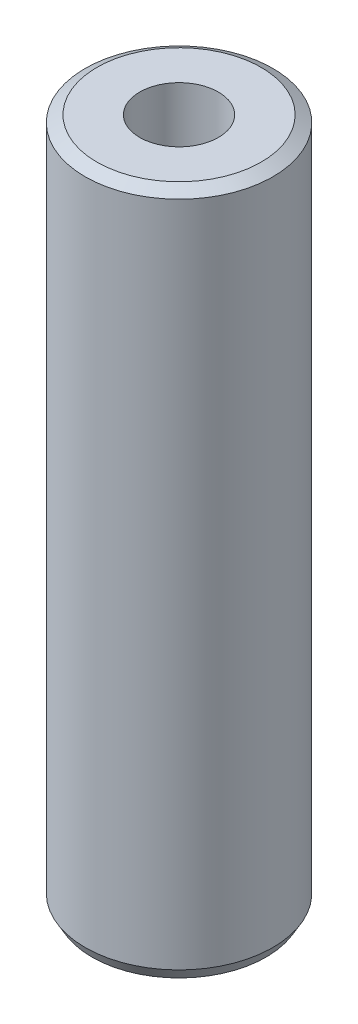
from build123d import *
from OCP.BRepFilletAPI import BRepFilletAPI_MakeChamfer

# Parameters (mm, degrees)
SKETCH1_R           = 55
BOSS_EXTRUDE1_DEPTH = 401.923267817
SKETCH2_R           = 23.058562901
CUT_EXTRUDE1_DEPTH  = 410.380401599
CHAMFER1_SIZE       = 3.979206531
CHAMFER1_SIZE2      = 6.892187885


with BuildPart() as part:
    # Sketch1 → Boss-Extrude1 (new body)
    with BuildSketch(Plane(origin=(0, 0, 0), x_dir=(1, 0, 0), z_dir=(0, 1, 0))):
        Circle(SKETCH1_R)
    extrude(amount=BOSS_EXTRUDE1_DEPTH)

    # Sketch2 → Cut-Extrude1 (cut, through all)
    with BuildSketch(Plane(origin=(0, 0, 0), x_dir=(1, 0, 0), z_dir=(0, 1, 0))):
        Circle(SKETCH2_R)
    extrude(amount=CUT_EXTRUDE1_DEPTH, mode=Mode.SUBTRACT)

    # Chamfer1: one chamfer whose edges measure the first distance from different faces: ONE call of the kernel's chamfer builder (chamfer() names one face for all edges)
    chamfer1_edges_1 = [part.edges().sort_by_distance(p)[0] for p in [
        (-55, 401.923267817, 0),
    ]]
    chamfer1_side_1 = [part.faces().sort_by_distance(p)[0] for p in [
        (-55, 200.961633909, 0),
    ]]
    chamfer1_edges_2 = [part.edges().sort_by_distance(p)[0] for p in [
        (-55, 0, 0),
    ]]
    chamfer1_side_2 = [part.faces().sort_by_distance(p)[0] for p in [
        (-53.444365081, 0, 0),
    ]]
    chamfer1 = BRepFilletAPI_MakeChamfer(part.part.solid().wrapped)
    for e in chamfer1_edges_1:
        chamfer1.Add(CHAMFER1_SIZE, CHAMFER1_SIZE2, e.wrapped, chamfer1_side_1[0].wrapped)  # the first distance lies on this face
    for e in chamfer1_edges_2:
        chamfer1.Add(CHAMFER1_SIZE, CHAMFER1_SIZE2, e.wrapped, chamfer1_side_2[0].wrapped)  # the first distance lies on this face
    add(Compound.cast(chamfer1.Shape()), mode=Mode.REPLACE)


solid = part.part
